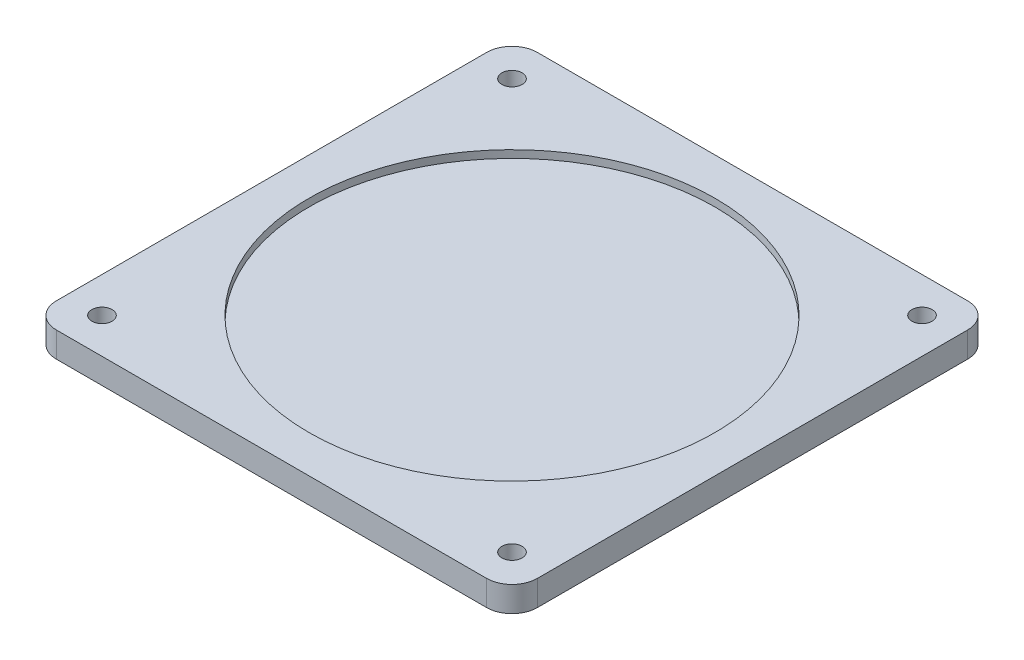
from build123d import *

# Parameters (mm, degrees)
SKETCH1_W             = 95
SKETCH1_H             = 95
SKETCH1_R             = 40.1
BOSS_EXTRUDE1_DEPTH   = 5
F_4_0MM_DOWEL_HOLE1_D = 4
FILLET1_R             = 5
SKETCH9_R             = 40.1
BOSS_EXTRUDE4_DEPTH   = 3.5


with BuildPart() as part:
    # Sketch1 → Boss-Extrude1 (new body)
    with BuildSketch(Plane(origin=(0, 0, 0), x_dir=(1, 0, 0), z_dir=(0, 1, 0))):
        Rectangle(SKETCH1_W, SKETCH1_H)
        Circle(SKETCH1_R, mode=Mode.SUBTRACT)
    extrude(amount=BOSS_EXTRUDE1_DEPTH)

    # Ø4.0mm Dowel Hole1 (through all)
    with Locations(Plane(origin=(0, 0, 0), x_dir=(-1, 0, 0), z_dir=(0, -1, 0))):
        with Locations((40.5, -40.5), (-40.5, -40.5), (-40.5, 40.5), (40.5, 40.5)):
            Hole(F_4_0MM_DOWEL_HOLE1_D / 2)

    # Fillet1
    fillet1_edges = [part.edges().sort_by_distance(p)[0] for p in [
        (-47.5, 2.5, -47.5),
        (47.5, 2.5, -47.5),
        (47.5, 2.5, 47.5),
        (-47.5, 2.5, 47.5),
    ]]
    fillet(fillet1_edges, radius=FILLET1_R)

    # Sketch9 → Boss-Extrude4 (add)
    with BuildSketch(Plane.XZ):
        Circle(SKETCH9_R)
    extrude(amount=-BOSS_EXTRUDE4_DEPTH)


solid = part.part
